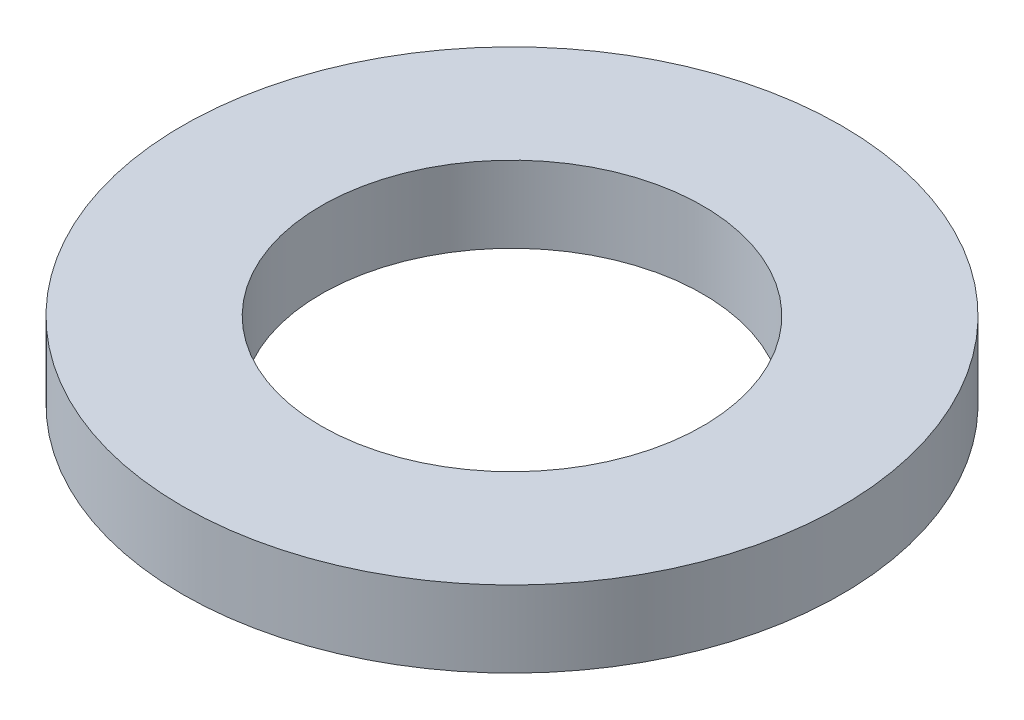
from build123d import *

# Parameters (mm, degrees)
SKETCH1_R           = 47.5
BOSS_EXTRUDE1_DEPTH = 11
SKETCH2_R           = 27.5
CUT_EXTRUDE1_DEPTH  = 69.0698171


with BuildPart() as part:
    # Sketch1 → Boss-Extrude1 (new body)
    with BuildSketch(Plane(origin=(0, 0, 0), x_dir=(1, 0, 0), z_dir=(0, 1, 0))):
        Circle(SKETCH1_R)
    extrude(amount=BOSS_EXTRUDE1_DEPTH)

    # Sketch2 → Cut-Extrude1 (cut, through all)
    with BuildSketch(Plane(origin=(0, 0, 0), x_dir=(1, 0, 0), z_dir=(0, 1, 0))):
        Circle(SKETCH2_R)
    extrude(amount=CUT_EXTRUDE1_DEPTH, mode=Mode.SUBTRACT)


solid = part.part
